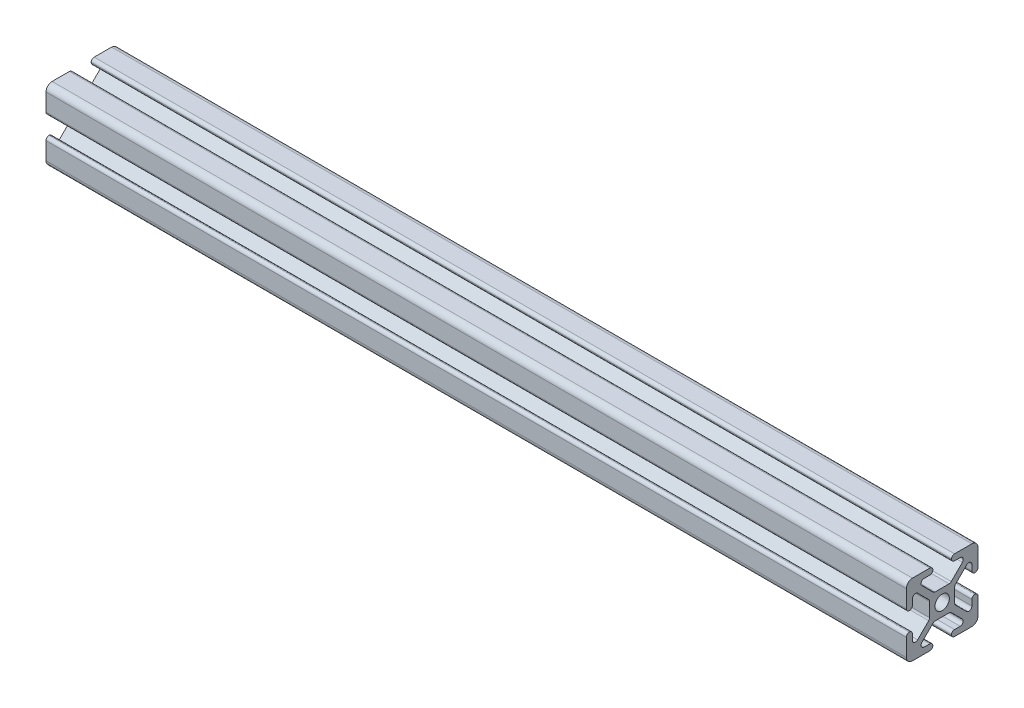
from build123d import *

# Parameters (mm, degrees)
SKETCH1_R           = 2.5
BOSS_EXTRUDE1_DEPTH = 300
FILLET1_R           = 1.065
FILLET2_R           = 2.13


with BuildPart() as part:
    # Sketch1 → Boss-Extrude1 (new body)
    with BuildSketch(Plane.YZ):
        Polygon((-12.5, -3.25), (-12.5, -12.5), (-3.25, -12.5), (-3.25, -10.37), (-8.863862556, -10.37), (-2.873862556, -4.38), (2.873862556, -4.38), (8.863862556, -10.37), (3.25, -10.37), (3.25, -12.5), (12.5, -12.5), (12.5, -3.25), (10.37, -3.25), (10.37, -8.863862556), (4.38, -2.873862556), (4.38, 2.873862556), (10.37, 8.863862556), (10.37, 3.25), (12.5, 3.25), (12.5, 12.5), (3.25, 12.5), (3.25, 10.37), (8.863862556, 10.37), (2.873862556, 4.38), (-2.873862556, 4.38), (-8.863862556, 10.37), (-3.25, 10.37), (-3.25, 12.5), (-12.5, 12.5), (-12.5, 3.25), (-10.37, 3.25), (-10.37, 8.863862556), (-4.38, 2.873862556), (-4.38, -2.873862556), (-10.37, -8.863862556), (-10.37, -3.25), align=None)
        with Locations(Location((0, 0, 0), (0, 0, 270))):
            Circle(SKETCH1_R, mode=Mode.SUBTRACT)
    extrude(amount=BOSS_EXTRUDE1_DEPTH)

    # Fillet1
    fillet1_edges = [part.edges().sort_by_distance(p)[0] for p in [
        (150, -10.37, -8.863862556),
        (150, 2.873862556, -4.38),
        (150, -2.873862556, -4.38),
        (150, -4.38, 2.873862556),
        (150, -4.38, -2.873862556),
        (150, -2.873862556, 4.38),
        (150, 2.873862556, 4.38),
        (150, 4.38, 2.873862556),
        (150, 4.38, -2.873862556),
        (150, -8.863862556, -10.37),
        (150, 8.863862556, -10.37),
        (150, 10.37, -8.863862556),
        (150, -10.37, 8.863862556),
        (150, -8.863862556, 10.37),
        (150, 10.37, 8.863862556),
        (150, 8.863862556, 10.37),
        (150, 12.5, 3.25),
        (150, -3.25, -12.5),
        (150, -10.37, 3.25),
        (150, 10.37, 3.25),
        (150, -10.37, -3.25),
        (150, -12.5, -3.25),
        (150, -12.5, 3.25),
        (150, 3.25, -10.37),
        (150, -3.25, -10.37),
        (150, 3.25, -12.5),
        (150, 10.37, -3.25),
        (150, 12.5, -3.25),
        (150, 3.25, 12.5),
        (150, 3.25, 10.37),
        (150, -3.25, 10.37),
        (150, -3.25, 12.5),
    ]]
    fillet(fillet1_edges, radius=FILLET1_R - 0.0001)  # a hair under: the kernel refuses the full size

    # Fillet2
    fillet2_edges = [part.edges().sort_by_distance(p)[0] for p in [
        (150, -12.5, 12.5),
        (150, 12.5, 12.5),
        (150, 12.5, -12.5),
        (150, -12.5, -12.5),
    ]]
    fillet(fillet2_edges, radius=FILLET2_R)


solid = part.part
